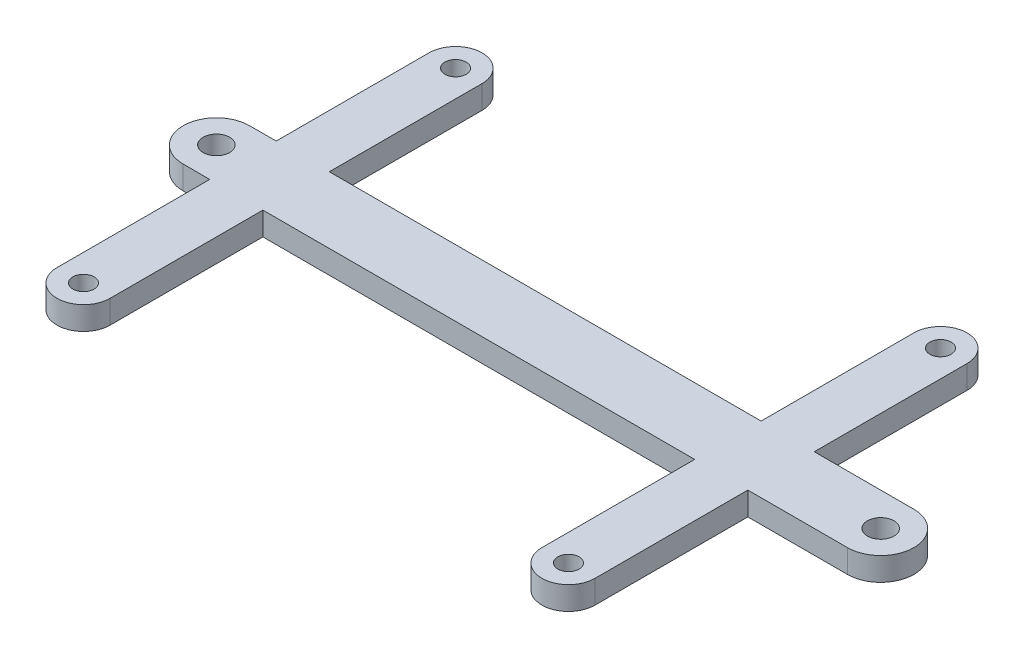
from build123d import *

# Parameters (mm, degrees)
SKETCH1_R           = 1.6
SKETCH1_R_2         = 2
BOSS_EXTRUDE1_DEPTH = 3.5


with BuildPart() as part:
    # Sketch1 → Boss-Extrude1 (new body)
    with BuildSketch(Plane(origin=(0, 0, 0), x_dir=(1, 0, 0), z_dir=(0, 1, 0))):
        with BuildLine():
            Line((35, 5), (35, 28))
            ThreePointArc((35, 28), (31, 32), (27, 28))
            Line((27, 28), (27, 5))
            Line((27, 5), (-38, 5))
            Line((-38, 5), (-38, 28))
            ThreePointArc((-38, 28), (-42, 32), (-46, 28))
            Line((-46, 28), (-46, 5))
            Line((-46, 5), (-50, 5))
            ThreePointArc((-50, 5), (-55, 0), (-50, -5))
            Line((-50, -5), (-46, -5))
            Line((-46, -5), (-46, -28))
            ThreePointArc((-46, -28), (-42, -32), (-38, -28))
            Line((-38, -28), (-38, -5))
            Line((-38, -5), (27, -5))
            Line((27, -5), (27, -28))
            ThreePointArc((27, -28), (31, -32), (35, -28))
            Line((35, -28), (35, -5))
            Line((35, -5), (50, -5))
            ThreePointArc((50, -5), (55, 0), (50, 5))
            Line((50, 5), (35, 5))
        make_face()
        with Locations((-42, -28)):
            Circle(SKETCH1_R, mode=Mode.SUBTRACT)
        with Locations((31, -28)):
            Circle(SKETCH1_R, mode=Mode.SUBTRACT)
        with Locations((-50, 0)):
            Circle(SKETCH1_R_2, mode=Mode.SUBTRACT)
        with Locations((-42, 28)):
            Circle(SKETCH1_R, mode=Mode.SUBTRACT)
        with Locations((50, 0)):
            Circle(SKETCH1_R_2, mode=Mode.SUBTRACT)
        with Locations((31, 28)):
            Circle(SKETCH1_R, mode=Mode.SUBTRACT)
    extrude(amount=BOSS_EXTRUDE1_DEPTH)


solid = part.part
